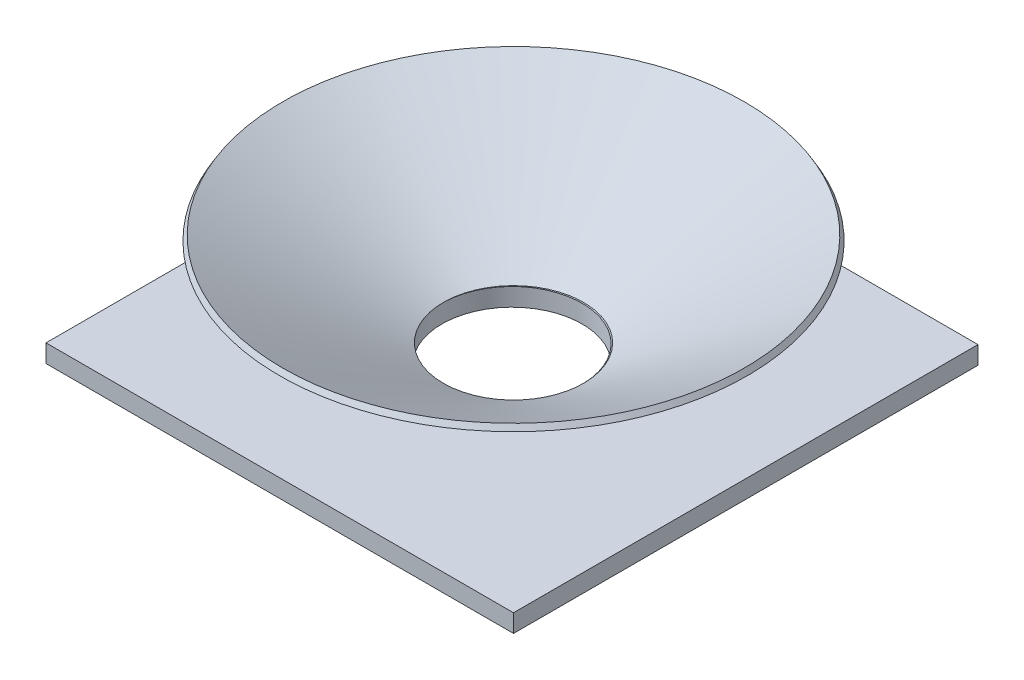
from build123d import *

# Parameters (mm, degrees)
SKETCH2_W           = 78.15
SKETCH2_H           = 77.647079997
SKETCH2_R           = 11.72
BOSS_EXTRUDE1_DEPTH = 3


with BuildPart() as part:
    # Sketch1 → Revolve1 (revolve)
    with BuildSketch(Plane.XY):
        Polygon((-13.706887802, 0), (-39.075, 14.760667037), (-38.572079997, 15.625), (-11.7185, 0), align=None)
    revolve(axis=Axis((0, 0, 0), (0, 1, 0)))


with BuildPart() as body_2:
    # Sketch2 → Boss-Extrude1 (new body)
    with BuildSketch(Plane(origin=(0, 0, 0), x_dir=(1, 0, 0), z_dir=(0, 1, 0))):
        with Locations((0, -0.251460001)):
            Rectangle(SKETCH2_W, SKETCH2_H)
        with Locations((0, -0.251460002)):
            Circle(SKETCH2_R, mode=Mode.SUBTRACT)
    extrude(amount=-BOSS_EXTRUDE1_DEPTH)


solid = Compound([part.part, body_2.part])
